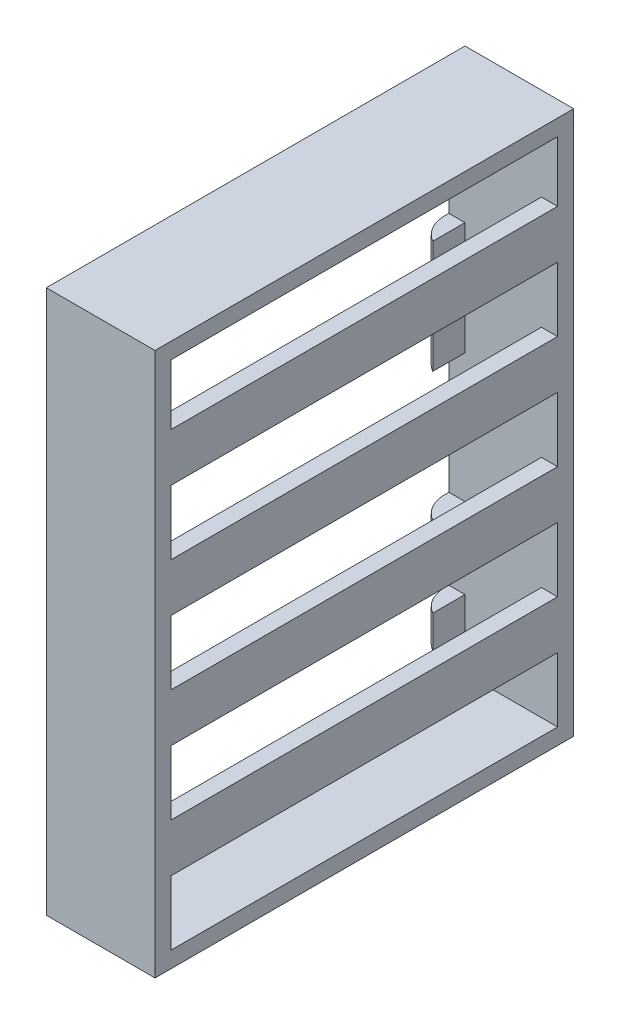
from build123d import *

# Parameters (mm, degrees)
SKETCH_1_W          = 13.5
SKETCH_1_H          = 67.5
EXTRUDE_1_DEPTH     = 52
CUT_EXTRUDE_1_REACH = 81.819
SKETCH_2_W          = 48
SKETCH_2_H          = 63.5
EXTRUDE_2_REACH     = 80.099
SKETCH_3_W          = 2
SKETCH_3_H          = 6
SKETCH_9_W          = 2
SKETCH_9_H          = 4
EXTRUDE_3_DEPTH     = 4
SKETCH_10_W         = 2
SKETCH_10_H         = 4
EXTRUDE_4_DEPTH     = 4
SKETCH_11_W         = 2
SKETCH_11_H         = 4
EXTRUDE_5_DEPTH     = 4
SKETCH_12_W         = 2
SKETCH_12_H         = 4
EXTRUDE_6_DEPTH     = 4
FILLET_1_R          = 4


with BuildPart() as part:
    # 草图1 → 凸台-拉伸1 (new body)
    with BuildSketch(Plane.XY):
        with Locations((3.959815951, -25.281820368)):
            Rectangle(SKETCH_1_W, SKETCH_1_H)
    extrude(amount=EXTRUDE_1_DEPTH)

    # 草图2 → 切除-拉伸1 (cut, up to next)
    with BuildSketch(Plane(origin=(10.709815951, 0, 0), x_dir=(0, 0, -1), z_dir=(1, 0, 0)), mode=Mode.PRIVATE) as cut_extrude_1_sk1:
        with Locations((-26, -25.281820368)):
            Rectangle(SKETCH_2_W, SKETCH_2_H)
    cut_extrude_1_tool1 = extrude(cut_extrude_1_sk1.sketch, amount=-CUT_EXTRUDE_1_REACH, mode=Mode.PRIVATE) & part.part
    add(cut_extrude_1_tool1.solids().sort_by_distance((10.709816, -25.28182, 26))[0], mode=Mode.SUBTRACT)

    # 草图3 → 凸台-拉伸2 (add, up to next)
    with BuildSketch(Plane(origin=(0, 0, 50), x_dir=(-1, 0, 0), z_dir=(0, 0, -1)), mode=Mode.PRIVATE) as extrude_2_sk1:
        with Locations((-9.709815951, -4.031820368)):
            Rectangle(SKETCH_3_W, SKETCH_3_H)
    extrude_2_tool1 = extrude(extrude_2_sk1.sketch, amount=EXTRUDE_2_REACH, mode=Mode.PRIVATE) - part.part
    # 草图3 → 凸台-拉伸2 (add, up to next)
    with BuildSketch(Plane(origin=(0, 0, 50), x_dir=(-1, 0, 0), z_dir=(0, 0, -1)), mode=Mode.PRIVATE) as extrude_2_sk2:
        with Locations((-9.709815951, -18.031820368)):
            Rectangle(SKETCH_3_W, SKETCH_3_H)
    extrude_2_tool2 = extrude(extrude_2_sk2.sketch, amount=EXTRUDE_2_REACH, mode=Mode.PRIVATE) - part.part
    # 草图3 → 凸台-拉伸2 (add, up to next)
    with BuildSketch(Plane(origin=(0, 0, 50), x_dir=(-1, 0, 0), z_dir=(0, 0, -1)), mode=Mode.PRIVATE) as extrude_2_sk3:
        with Locations((-9.709815951, -32.031820368)):
            Rectangle(SKETCH_3_W, SKETCH_3_H)
    extrude_2_tool3 = extrude(extrude_2_sk3.sketch, amount=EXTRUDE_2_REACH, mode=Mode.PRIVATE) - part.part
    # 草图3 → 凸台-拉伸2 (add, up to next)
    with BuildSketch(Plane(origin=(0, 0, 50), x_dir=(-1, 0, 0), z_dir=(0, 0, -1)), mode=Mode.PRIVATE) as extrude_2_sk4:
        with Locations((-9.709815951, -46.031820368)):
            Rectangle(SKETCH_3_W, SKETCH_3_H)
    extrude_2_tool4 = extrude(extrude_2_sk4.sketch, amount=EXTRUDE_2_REACH, mode=Mode.PRIVATE) - part.part
    add(extrude_2_tool1.solids().sort_by_distance((9.709816, -4.03182, 50))[0])
    add(extrude_2_tool2.solids().sort_by_distance((9.709816, -18.03182, 50))[0])
    add(extrude_2_tool3.solids().sort_by_distance((9.709816, -32.03182, 50))[0])
    add(extrude_2_tool4.solids().sort_by_distance((9.709816, -46.03182, 50))[0])

    # 草图9 → 凸台-拉伸3 (add)
    with BuildSketch(Plane(origin=(0, 0, 50), x_dir=(-1, 0, 0), z_dir=(0, 0, -1))):
        with Locations((1.790184049, -0.531820368)):
            Rectangle(SKETCH_9_W, SKETCH_9_H)
        with Locations((1.790184049, -10.531820368)):
            Rectangle(SKETCH_9_W, SKETCH_9_H)
        with Locations((1.790184049, -20.531820368)):
            Rectangle(SKETCH_9_W, SKETCH_9_H)
        with Locations((1.790184049, -30.531820368)):
            Rectangle(SKETCH_9_W, SKETCH_9_H)
        with Locations((1.790184049, -40.531820368)):
            Rectangle(SKETCH_9_W, SKETCH_9_H)
        with Locations((1.790184049, -50.531820368)):
            Rectangle(SKETCH_9_W, SKETCH_9_H)
    extrude(amount=EXTRUDE_3_DEPTH)

    # 草图10 → 凸台-拉伸4 (add)
    with BuildSketch(Plane.XZ.offset(-6.468179632)):
        with Locations((-1.790184049, 8)):
            Rectangle(SKETCH_10_W, SKETCH_10_H)
        with Locations((-1.790184049, 17)):
            Rectangle(SKETCH_10_W, SKETCH_10_H)
        with Locations((-1.790184049, 26)):
            Rectangle(SKETCH_10_W, SKETCH_10_H)
        with Locations((-1.790184049, 35)):
            Rectangle(SKETCH_10_W, SKETCH_10_H)
        with Locations((-1.790184049, 44)):
            Rectangle(SKETCH_10_W, SKETCH_10_H)
    extrude(amount=EXTRUDE_4_DEPTH)

    # 草图11 → 凸台-拉伸5 (add)
    with BuildSketch(Plane(origin=(0, -57.031820368, 0), x_dir=(1, 0, 0), z_dir=(0, 1, 0))):
        with Locations((-1.790184049, -44)):
            Rectangle(SKETCH_11_W, SKETCH_11_H)
        with Locations((-1.790184049, -35)):
            Rectangle(SKETCH_11_W, SKETCH_11_H)
        with Locations((-1.790184049, -26)):
            Rectangle(SKETCH_11_W, SKETCH_11_H)
        with Locations((-1.790184049, -17)):
            Rectangle(SKETCH_11_W, SKETCH_11_H)
        with Locations((-1.790184049, -8)):
            Rectangle(SKETCH_11_W, SKETCH_11_H)
    extrude(amount=EXTRUDE_5_DEPTH)

    # 草图12 → 凸台-拉伸6 (add)
    with BuildSketch(Plane.XY.offset(2)):
        with Locations((-1.790184049, -0.531820368)):
            Rectangle(SKETCH_12_W, SKETCH_12_H)
        with Locations((-1.790184049, -10.531820368)):
            Rectangle(SKETCH_12_W, SKETCH_12_H)
        with Locations((-1.790184049, -20.531820368)):
            Rectangle(SKETCH_12_W, SKETCH_12_H)
        with Locations((-1.790184049, -30.531820368)):
            Rectangle(SKETCH_12_W, SKETCH_12_H)
        with Locations((-1.790184049, -40.531820368)):
            Rectangle(SKETCH_12_W, SKETCH_12_H)
        with Locations((-1.790184049, -50.531820368)):
            Rectangle(SKETCH_12_W, SKETCH_12_H)
    extrude(amount=EXTRUDE_6_DEPTH)

    # 圆角1
    # the kernel refuses this fillet: 4 mm, written as the material it takes off along each edge
    with BuildSketch(Plane(origin=(-2.790184049, -39.871566331, 46), x_dir=(0, 0, 1), z_dir=(0, -1, 0))) as fillet_1_piece_1_section:
        with BuildLine():
            CenterArc((3.464101615, -4), FILLET_1_R, 90, 60)
            Line((0, -2), (0, 0))
            Line((0, 0), (3.464101615, 0))
        make_face()
    fillet_1_piece_1 = extrude(amount=21.320508076, mode=Mode.PRIVATE)
    fillet_1_piece_1 = split(fillet_1_piece_1, bisect_by=Plane(origin=(-2.261213867, -53.031820368, 47.460101615), z_dir=(0, 1, 0)), keep=Keep.TOP, mode=Mode.PRIVATE)
    add(fillet_1_piece_1, mode=Mode.SUBTRACT)
    with BuildSketch(Plane(origin=(-2.790184049, -53.031820368, 46), x_dir=(0, -1, 0), z_dir=(0, 0, -1)), Plane(origin=(-2.790184049, -11.192074406, 6), x_dir=(0, 0, -1), z_dir=(0, 1, 0)), Plane(origin=(-2.790184049, 2.468179632, 6), x_dir=(0, 1, 0), z_dir=(0, 0, 1))) as fillet_1_piece_2:
        with BuildLine():
            CenterArc((3.464101615, -4), FILLET_1_R, 90, 60)
            Line((0, -2), (0, 0))
            Line((0, 0), (3.464101615, 0))
        make_face()
    extrude(amount=12.660254038, mode=Mode.SUBTRACT)
    with BuildSketch(Plane(origin=(-2.790184049, -29.871566331, 46), x_dir=(0, 0, 1), z_dir=(0, -1, 0)), Plane(origin=(-2.790184049, -19.871566331, 46), x_dir=(0, 0, 1), z_dir=(0, -1, 0)), Plane(origin=(-2.790184049, 0.128433669, 46), x_dir=(0, 0, 1), z_dir=(0, -1, 0)), Plane(origin=(-2.790184049, -9.871566331, 46), x_dir=(0, 0, 1), z_dir=(0, -1, 0))) as fillet_1_piece_3:
        with BuildLine():
            CenterArc((3.464101615, -4), FILLET_1_R, 90, 60)
            Line((0, -2), (0, 0))
            Line((0, 0), (3.464101615, 0))
        make_face()
    extrude(amount=21.320508076, mode=Mode.SUBTRACT)
    with BuildSketch(Plane(origin=(-2.790184049, -53.031820368, 24.339745962), x_dir=(0, -1, 0), z_dir=(0, 0, 1)), Plane(origin=(-2.790184049, -53.031820368, 15.339745962), x_dir=(0, -1, 0), z_dir=(0, 0, 1)), Plane(origin=(-2.790184049, -53.031820368, 6.339745962), x_dir=(0, -1, 0), z_dir=(0, 0, 1)), Plane(origin=(-2.790184049, -29.871566331, 6), x_dir=(0, 0, -1), z_dir=(0, -1, 0)), Plane(origin=(-2.790184049, -9.871566331, 6), x_dir=(0, 0, -1), z_dir=(0, -1, 0)), Plane(origin=(-2.790184049, -19.871566331, 6), x_dir=(0, 0, -1), z_dir=(0, -1, 0)), Plane(origin=(-2.790184049, 0.128433669, 6), x_dir=(0, 0, -1), z_dir=(0, -1, 0)), Plane(origin=(-2.790184049, 2.468179632, 27.660254038), x_dir=(0, 1, 0), z_dir=(0, 0, -1)), Plane(origin=(-2.790184049, 2.468179632, 36.660254038), x_dir=(0, 1, 0), z_dir=(0, 0, -1)), Plane(origin=(-2.790184049, 2.468179632, 45.660254038), x_dir=(0, 1, 0), z_dir=(0, 0, -1))) as fillet_1_piece_4:
        with BuildLine():
            CenterArc((3.464101615, 4), FILLET_1_R, 210, 60)
            Line((0, 2), (0, 0))
            Line((0, 0), (3.464101615, 0))
        make_face()
    extrude(amount=21.320508076, mode=Mode.SUBTRACT)
    with BuildSketch(Plane(origin=(-2.790184049, -39.871566331, 6), x_dir=(0, 0, -1), z_dir=(0, -1, 0)), Plane(origin=(-2.790184049, 2.468179632, 46), x_dir=(0, 1, 0), z_dir=(0, 0, -1))) as fillet_1_piece_5:
        with BuildLine():
            CenterArc((3.464101615, 4), FILLET_1_R, 210, 60)
            Line((0, 2), (0, 0))
            Line((0, 0), (3.464101615, 0))
        make_face()
    extrude(amount=12.660254038, mode=Mode.SUBTRACT)
    with BuildSketch(Plane(origin=(-2.790184049, -53.031820368, -2.660254038), x_dir=(0, -1, 0), z_dir=(0, 0, 1))) as fillet_1_piece_6_section:
        with BuildLine():
            CenterArc((3.464101615, 4), FILLET_1_R, 210, 60)
            Line((0, 2), (0, 0))
            Line((0, 0), (3.464101615, 0))
        make_face()
    fillet_1_piece_6 = extrude(amount=21.320508076, mode=Mode.PRIVATE)
    fillet_1_piece_6 = split(fillet_1_piece_6, bisect_by=Plane(origin=(-2.261213867, -54.491921984, 2), z_dir=(0, 0, 1)), keep=Keep.TOP, mode=Mode.PRIVATE)
    add(fillet_1_piece_6, mode=Mode.SUBTRACT)
    with BuildSketch(Plane(origin=(-2.790184049, -11.192074406, 46), x_dir=(0, 0, 1), z_dir=(0, 1, 0))) as fillet_1_piece_7_section:
        with BuildLine():
            CenterArc((3.464101615, 4), FILLET_1_R, 210, 60)
            Line((0, 2), (0, 0))
            Line((0, 0), (3.464101615, 0))
        make_face()
    fillet_1_piece_7 = extrude(amount=21.320508076, mode=Mode.PRIVATE)
    fillet_1_piece_7 = split(fillet_1_piece_7, bisect_by=Plane(origin=(-2.261213867, 2.468179632, 47.460101615), z_dir=(0, -1, 0)), keep=Keep.TOP, mode=Mode.PRIVATE)
    add(fillet_1_piece_7, mode=Mode.SUBTRACT)


solid = part.part
